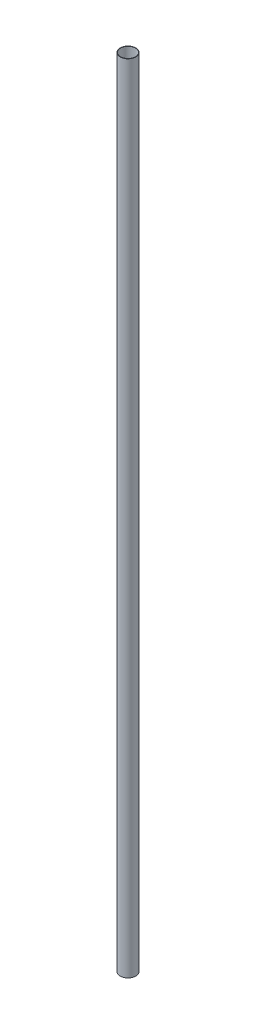
from build123d import *

# Parameters (mm, degrees)
SKETCH2_R           = 10.033
SKETCH2_R_2         = 9.525
BOSS_EXTRUDE1_DEPTH = 1016


with BuildPart() as part:
    # Sketch2 → Boss-Extrude1 (new body)
    with BuildSketch(Plane(origin=(0, 0, 0), x_dir=(1, 0, 0), z_dir=(0, 1, 0))):
        Circle(SKETCH2_R)
        Circle(SKETCH2_R_2, mode=Mode.SUBTRACT)
    extrude(amount=BOSS_EXTRUDE1_DEPTH)


solid = part.part
